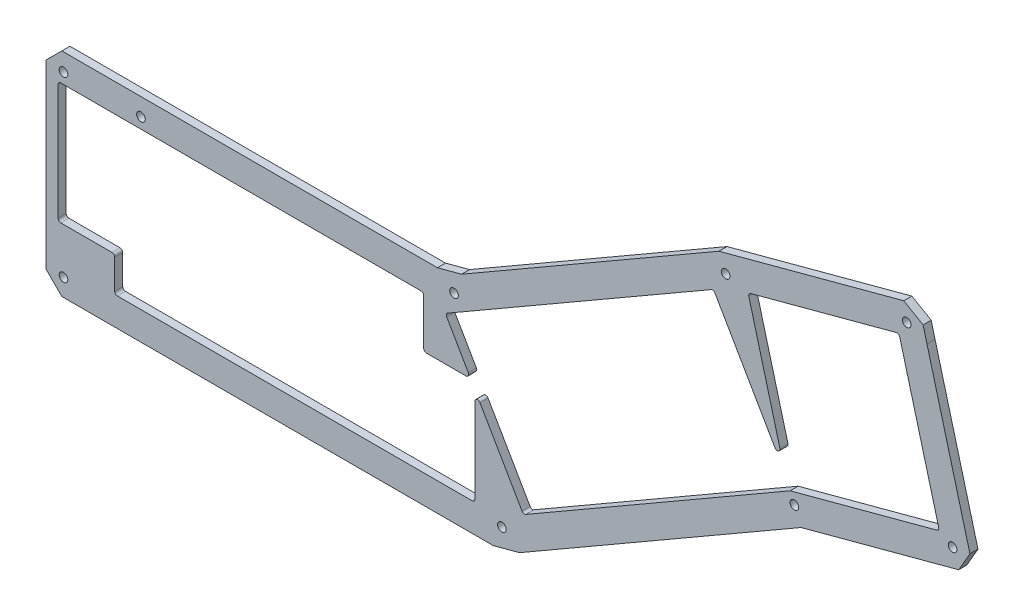
from build123d import *

# Parameters (mm, degrees)
ESQUISSE1_R        = 1.6
BOSS_EXTRU_1_DEPTH = 3


with BuildPart() as part:
    # Esquisse1 → Boss.-Extru.1 (new body)
    with BuildSketch(Plane.XY):
        Polygon((-75.988646329, 50.585106383), (-96.375082906, 50.585106383), (-102.253762562, 44.706426727), (-102.253762562, 35.79522772), (-102.253762562, -22.536213961), (-96.375082906, -28.414893617), (63.866204609, -28.414893617), (73.57783127, -25.812671096), (178.129773206, 34.550420725), (236.676113061, 50.237865209), (240.83296731, 57.437747969), (229.542938833, 99.572707865), (224.885316316, 116.95519174), (223.46218398, 122.391704558), (216.287606244, 126.561599525), (210.79963, 125.091100722), (147.636911389, 108.166701279), (52.055735868, 52.982883862), (43.107108491, 50.585106383), align=None)
        with Locations((-95.753762562, 44.085106383)):
            Circle(ESQUISSE1_R, mode=Mode.SUBTRACT)
        with Locations((-66.988646329, 44.085106383)):
            Circle(ESQUISSE1_R, mode=Mode.SUBTRACT)
        with Locations((-95.753762562, -21.914893617)):
            Circle(ESQUISSE1_R, mode=Mode.SUBTRACT)
        with Locations((49.263745973, 45.505477252)):
            Circle(ESQUISSE1_R, mode=Mode.SUBTRACT)
        with Locations((67.039694146, -20.835264486)):
            Circle(ESQUISSE1_R, mode=Mode.SUBTRACT)
        with Locations((175.637377655, 40.567595866)):
            Circle(ESQUISSE1_R, mode=Mode.SUBTRACT)
        with Locations((234.393639901, 56.355573542)):
            Circle(ESQUISSE1_R, mode=Mode.SUBTRACT)
        with Locations((217.363403759, 120.120565138)):
            Circle(ESQUISSE1_R, mode=Mode.SUBTRACT)
        with Locations((150.12930694, 102.149526137)):
            Circle(ESQUISSE1_R, mode=Mode.SUBTRACT)
        with BuildLine():
            Line((-97.753762562, 39.085106383), (-97.753762562, 2.085106383))
            Line((-97.753762562, 2.085106383), (-97.753762562, -3.914893617))
            ThreePointArc((-97.753762562, -3.914893617), (-97.460869343, -4.622000398), (-96.753762562, -4.914893617))
            Line((-96.753762562, -4.914893617), (-77.753762562, -4.914893617))
            ThreePointArc((-77.753762562, -4.914893617), (-77.046655781, -5.207786836), (-76.753762562, -5.914893617))
            Line((-76.753762562, -5.914893617), (-76.753762562, -16.914893617))
            ThreePointArc((-76.753762562, -16.914893617), (-76.460869343, -17.622000398), (-75.753762562, -17.914893617))
            Line((-75.753762562, -17.914893617), (56.011353671, -17.914893617))
            ThreePointArc((56.011353671, -17.914893617), (56.718460453, -17.622000398), (57.011353671, -16.914893617))
            Line((57.011353671, -16.914893617), (57.011353671, 14.621004768))
            ThreePointArc((57.011353671, 14.621004768), (57.752534626, 15.586930594), (58.877379075, 15.121004768))
            Line((58.877379075, 15.121004768), (74.527293708, -11.98544251))
            ThreePointArc((74.527293708, -11.98544251), (75.134500067, -12.451368337), (75.893319112, -12.351467914))
            Line((75.893319112, -12.351467914), (174.076924484, 44.334863077))
            Line((174.076924484, 44.334863077), (228.528734589, 58.925181621))
            ThreePointArc((228.528734589, 58.925181621), (229.135940948, 59.391107448), (229.235841371, 60.149926493))
            Line((229.235841371, 60.149926493), (214.741974845, 114.241772765))
            ThreePointArc((214.741974845, 114.241772765), (214.276049019, 114.848979124), (213.517229973, 114.948879546))
            Line((213.517229973, 114.948879546), (159.425383701, 100.45501302))
            ThreePointArc((159.425383701, 100.45501302), (158.818177343, 99.989087194), (158.71827692, 99.230268149))
            Line((158.71827692, 99.230268149), (170.271736655, 56.112169417))
            ThreePointArc((170.271736655, 56.112169417), (169.688494261, 54.929470839), (168.439785425, 55.353350371))
            Line((168.439785425, 55.353350371), (146.120215143, 94.011980101))
            ThreePointArc((146.120215143, 94.011980101), (145.513008785, 94.477905928), (144.75418974, 94.378005505))
            Line((144.75418974, 94.378005505), (46.893319112, 37.878005505))
            ThreePointArc((46.893319112, 37.878005505), (46.427393286, 37.270799147), (46.527293708, 36.511980101))
            Line((46.527293708, 36.511980101), (54.567977999, 22.585106383))
            ThreePointArc((54.567977999, 22.585106383), (54.567977999, 21.585106383), (53.701952595, 21.085106383))
            Line((53.701952595, 21.085106383), (39.011353671, 21.085106383))
            ThreePointArc((39.011353671, 21.085106383), (38.30424689, 21.377999602), (38.011353671, 22.085106383))
            Line((38.011353671, 22.085106383), (38.011353671, 39.085106383))
            ThreePointArc((38.011353671, 39.085106383), (37.718460453, 39.792213164), (37.011353671, 40.085106383))
            Line((37.011353671, 40.085106383), (-96.753762562, 40.085106383))
            ThreePointArc((-96.753762562, 40.085106383), (-97.460869343, 39.792213164), (-97.753762562, 39.085106383))
        make_face(mode=Mode.SUBTRACT)
    extrude(amount=BOSS_EXTRU_1_DEPTH)


solid = part.part
